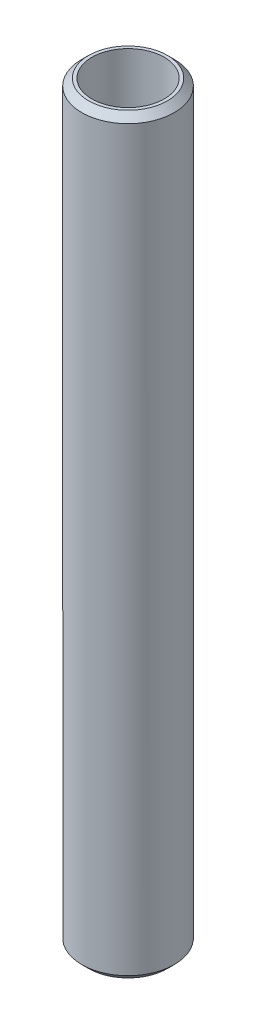
from build123d import *

# Parameters (mm, degrees)
SKETCH1_R           = 22.5
BOSS_EXTRUDE1_DEPTH = 365.881459211
SKETCH2_R           = 17.610893448
CUT_EXTRUDE1_DEPTH  = 368.262497669
CHAMFER1_SIZE       = 3.323532986


with BuildPart() as part:
    # Sketch1 → Boss-Extrude1 (new body)
    with BuildSketch(Plane(origin=(0, 0, 0), x_dir=(1, 0, 0), z_dir=(0, 1, 0))):
        Circle(SKETCH1_R)
    extrude(amount=BOSS_EXTRUDE1_DEPTH)

    # Sketch2 → Cut-Extrude1 (cut, through all)
    with BuildSketch(Plane(origin=(0, 0, 0), x_dir=(1, 0, 0), z_dir=(0, 1, 0))):
        Circle(SKETCH2_R)
    extrude(amount=CUT_EXTRUDE1_DEPTH, mode=Mode.SUBTRACT)

    # Chamfer1
    chamfer1_edges = [part.edges().sort_by_distance(p)[0] for p in [
        (-22.5, 365.881459211, 0),
        (-22.5, 0, 0),
    ]]
    chamfer(chamfer1_edges, length=CHAMFER1_SIZE)


solid = part.part
